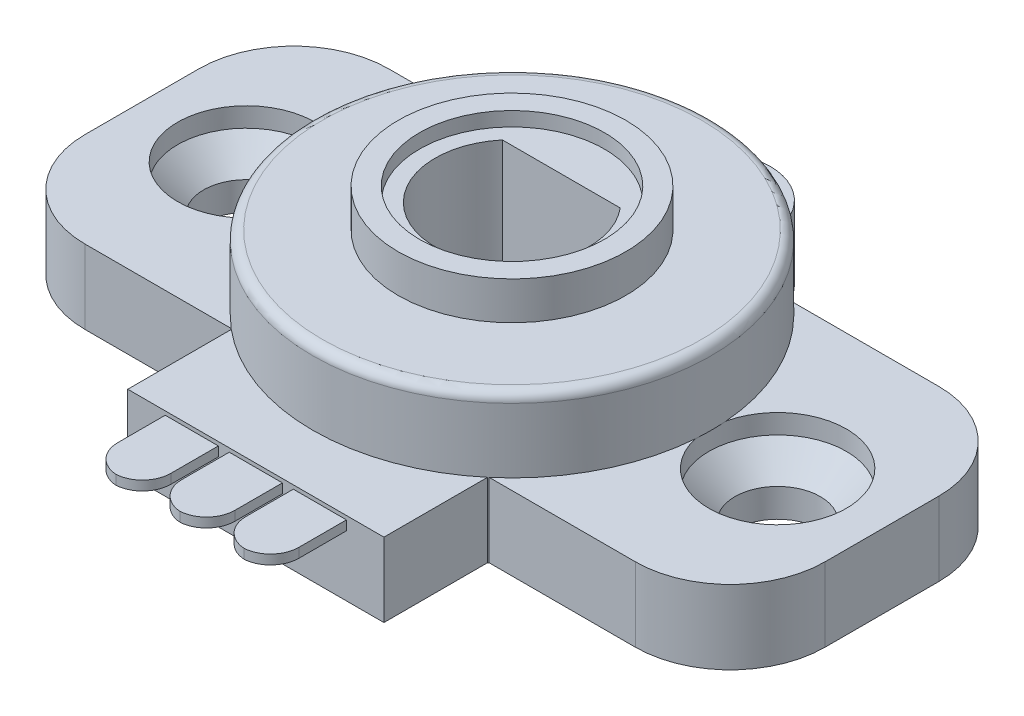
from build123d import *

# Parameters (mm, degrees)
BOSS_EXTRUDE1_DEPTH = 3.9
SKETCH3_R           = 2.25
CUT_EXTRUDE1_DEPTH  = 25.091907
BOSS_EXTRUDE3_START = -3.9
SKETCH6_R           = 10.5
BOSS_EXTRUDE3_DEPTH = 7.8
SKETCH4_R           = 3.625
CUT_EXTRUDE2_DEPTH  = 2.4
BOSS_EXTRUDE4_START = -7.8
SKETCH7_R           = 6
BOSS_EXTRUDE4_DEPTH = 9.8
SKETCH8_R           = 4.875
CUT_EXTRUDE3_DEPTH  = 0.75
CUT_EXTRUDE4_DEPTH  = 26.438406
SKETCH10_R          = 6
CUT_EXTRUDE5_DEPTH  = 1.75
BOSS_EXTRUDE5_START = 3.2
SKETCH11_W          = 2.8
SKETCH11_H          = 4
BOSS_EXTRUDE5_DEPTH = 0.5
FILLET1_R           = 1.5
FILLET2_R           = 0.5


with BuildPart() as part:
    # Sketch2 → Boss-Extrude1 (new body)
    with BuildSketch(Plane(origin=(0, 0, 0), x_dir=(1, 0, 0), z_dir=(0, 1, 0))):
        with BuildLine():
            Line((-19.5, 3), (-19.5, -3))
            ThreePointArc((-19.5, -3), (-18.035534, -6.535534), (-14.5, -8))
            Line((-14.5, -8), (-6.75, -8))
            Line((-6.75, -8), (-6.75, -13.5))
            Line((-6.75, -13.5), (6.75, -13.5))
            Line((6.75, -13.5), (6.75, -8))
            Line((6.75, -8), (14.5, -8))
            ThreePointArc((14.5, -8), (18.035534, -6.535534), (19.5, -3))
            Line((19.5, -3), (19.5, 3))
            ThreePointArc((19.5, 3), (18.035534, 6.535534), (14.5, 8))
            Line((14.5, 8), (6.800735, 8))
            ThreePointArc((6.800735, 8), (5.037969, 9.21243), (3.066037, 10.042381))
            ThreePointArc((3.066037, 10.042381), (0, 13.6), (-3.066037, 10.042381))
            ThreePointArc((-3.066037, 10.042381), (-5.037969, 9.21243), (-6.800735, 8))
            Line((-6.800735, 8), (-14.5, 8))
            ThreePointArc((-14.5, 8), (-18.035534, 6.535534), (-19.5, 3))
        make_face()
    extrude(amount=BOSS_EXTRUDE1_DEPTH)

    # Sketch3 → Cut-Extrude1 (cut, through all)
    with BuildSketch(Plane(origin=(0, 3.9, 0), x_dir=(1, 0, 0), z_dir=(0, 1, 0))):
        with Locations(Location((-14, 0, 0), (0, 0, 270))):
            Circle(SKETCH3_R)
    cut_extrude1 = extrude(amount=-CUT_EXTRUDE1_DEPTH, mode=Mode.SUBTRACT)

    # Sketch6 → Boss-Extrude3 (add)
    with BuildSketch(Plane(origin=(0, 3.9, 0), x_dir=(1, 0, 0), z_dir=(0, 1, 0)).offset(BOSS_EXTRUDE3_START)):
        with Locations(Location((0, 0, 0), (0, 0, 73.022056))):
            Circle(SKETCH6_R)
    extrude(amount=BOSS_EXTRUDE3_DEPTH)

    # Sketch4 → Cut-Extrude2 (cut)
    with BuildSketch(Plane(origin=(0, 3.9, 0), x_dir=(1, 0, 0), z_dir=(0, 1, 0))):
        with Locations(Location((-14, 0, 0), (0, 0, 270))):
            Circle(SKETCH4_R)
    cut_extrude2 = extrude(amount=-CUT_EXTRUDE2_DEPTH, mode=Mode.SUBTRACT)

    # Sketch5 → Revolve1 (revolve)
    with BuildSketch(Plane.XY, mode=Mode.PRIVATE) as revolve1_sk:
        Polygon((-16.25, 1.5), (-17.625, 2.875), (-17.625, 1.5), align=None)
    revolve1 = revolve(revolve1_sk.sketch.rotate(Axis((-14, -999.202494, 0), (0, 1, 0)), 90), axis=Axis((-14, -999.202494, 0), (0, 1, 0)))

    # Mirror1: Cut-Extrude1, Cut-Extrude2, Revolve1 across plane
    add(cut_extrude1.mirror(Plane(origin=(0, 0, 0), x_dir=(0, 0, 1), z_dir=(1, 0, 0))), mode=Mode.SUBTRACT)
    add(cut_extrude2.mirror(Plane(origin=(0, 0, 0), x_dir=(0, 0, 1), z_dir=(1, 0, 0))), mode=Mode.SUBTRACT)
    add(revolve1.mirror(Plane(origin=(0, 0, 0), x_dir=(0, 0, 1), z_dir=(1, 0, 0))))

    # Sketch7 → Boss-Extrude4 (add)
    with BuildSketch(Plane(origin=(0, 7.8, 0), x_dir=(1, 0, 0), z_dir=(0, 1, 0)).offset(BOSS_EXTRUDE4_START)):
        with Locations(Location((0, 0, 0), (0, 0, 270))):
            Circle(SKETCH7_R)
    extrude(amount=BOSS_EXTRUDE4_DEPTH)

    # Sketch8 → Cut-Extrude3 (cut)
    with BuildSketch(Plane(origin=(0, 9.8, 0), x_dir=(1, 0, 0), z_dir=(0, 1, 0))):
        with Locations(Location((0, 0, 0), (0, 0, 270))):
            Circle(SKETCH8_R)
    extrude(amount=-CUT_EXTRUDE3_DEPTH, mode=Mode.SUBTRACT)

    # Sketch9 → Cut-Extrude4 (cut, through all)
    with BuildSketch(Plane(origin=(0, 9.05, 0), x_dir=(1, 0, 0), z_dir=(0, 1, 0))):
        with BuildLine():
            Line((-3.105238, 2.6), (3.105238, 2.6))
            ThreePointArc((3.105238, 2.6), (0, -4.05), (-3.105238, 2.6))
        make_face()
    extrude(amount=-CUT_EXTRUDE4_DEPTH, mode=Mode.SUBTRACT)

    # Sketch10 → Cut-Extrude5 (cut)
    with BuildSketch(Plane.XZ):
        with Locations(Location((0, 0, 0), (0, 0, 90))):
            Circle(SKETCH10_R)
    extrude(amount=-CUT_EXTRUDE5_DEPTH, mode=Mode.SUBTRACT)

    # Sketch11 → Boss-Extrude5 (add)
    with BuildSketch(Plane(origin=(0, 0, 0), x_dir=(1, 0, 0), z_dir=(0, 1, 0)).offset(BOSS_EXTRUDE5_START)):
        with Locations((-3.375, -15.5)):
            Rectangle(SKETCH11_W, SKETCH11_H)
        with Locations((0, -15.5)):
            Rectangle(SKETCH11_W, SKETCH11_H)
        with Locations((3.375, -15.5)):
            Rectangle(SKETCH11_W, SKETCH11_H)
    extrude(amount=BOSS_EXTRUDE5_DEPTH)

    # Fillet1
    # the kernel refuses this fillet: 1.5 mm, written as the material it takes off along each edge
    with BuildSketch(Plane(origin=(-4.775, -0.55, 17.5), x_dir=(0, 0, -1), z_dir=(0, 1, 0)), Plane(origin=(-1.4, -0.55, 17.5), x_dir=(0, 0, -1), z_dir=(0, 1, 0)), Plane(origin=(1.975, -0.55, 17.5), x_dir=(0, 0, -1), z_dir=(0, 1, 0))) as fillet1_piece_1:
        with BuildLine():
            CenterArc((FILLET1_R, -FILLET1_R), FILLET1_R, 90, 90)
            Line((0, -FILLET1_R), (0, 0))
            Line((0, 0), (FILLET1_R, 0))
        make_face()
    extrude(amount=8, mode=Mode.SUBTRACT)
    with BuildSketch(Plane(origin=(-1.975, -0.55, 17.5), x_dir=(0, 0, -1), z_dir=(0, 1, 0)), Plane(origin=(1.4, -0.55, 17.5), x_dir=(0, 0, -1), z_dir=(0, 1, 0)), Plane(origin=(4.775, -0.55, 17.5), x_dir=(0, 0, -1), z_dir=(0, 1, 0))) as fillet1_piece_2:
        with BuildLine():
            CenterArc((FILLET1_R, FILLET1_R), FILLET1_R, 180, 90)
            Line((0, FILLET1_R), (0, 0))
            Line((0, 0), (FILLET1_R, 0))
        make_face()
    extrude(amount=8, mode=Mode.SUBTRACT)

    # Fillet2
    fillet2_edges = [part.edges().sort_by_distance(p)[0] for p in [
        (-3.066037, 7.8, 10.042381),
    ]]
    fillet(fillet2_edges, radius=FILLET2_R)


solid = part.part
